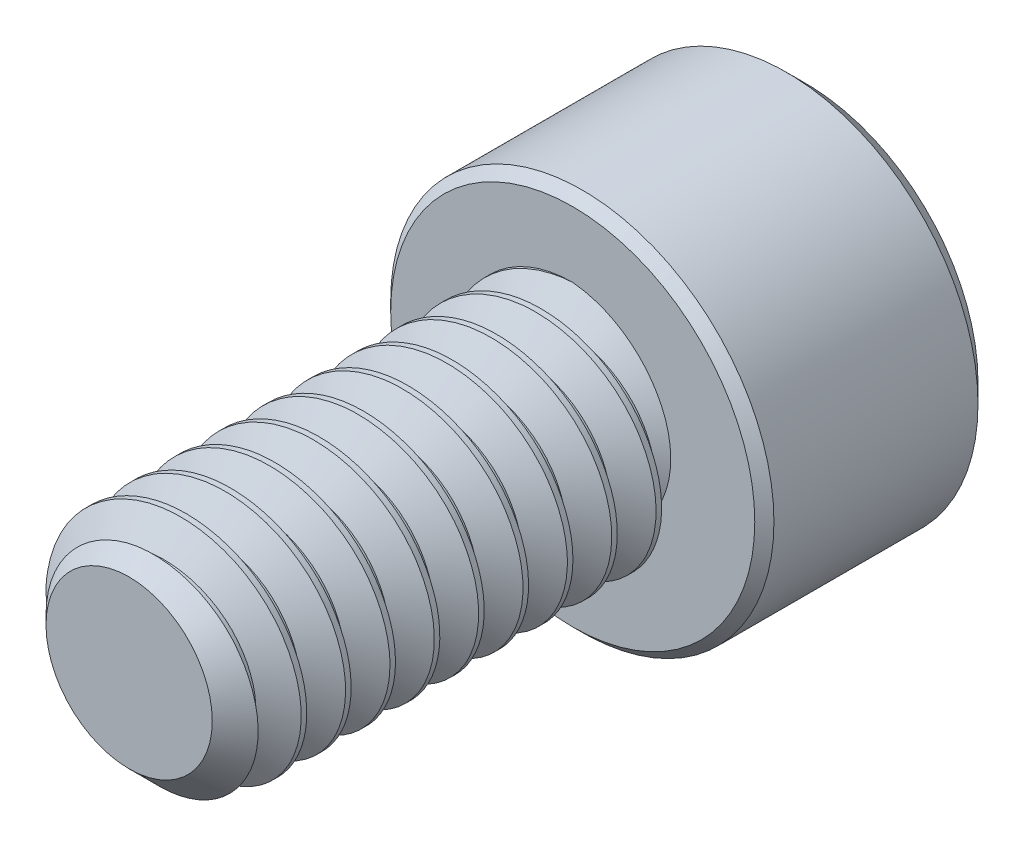
from build123d import *

# Parameters (mm, degrees)
SKETCH1_R          = 2.0828
EXTRUDE1_DEPTH     = 7.9375
CHAMFER3_SIZE      = 0.5953125
CUT_SWEEP1_PITCH   = 0.79375
SKETCH6_R          = 3.429
EXTRUDE2_DEPTH     = 4.1656
CUT_EXTRUDE1_DEPTH = 2.67890625
CHAMFER1_SIZE      = 0.3429
CHAMFER2_SIZE      = 0.17145


with BuildPart() as part:
    # Sketch1 → Extrude1 (new body)
    with BuildSketch(Plane.XY):
        Circle(SKETCH1_R)
    extrude(amount=-EXTRUDE1_DEPTH)

    # Chamfer3
    chamfer3_edges = [part.edges().sort_by_distance(p)[0] for p in [
        (-2.0828, 0, 0),
    ]]
    chamfer(chamfer3_edges, length=CHAMFER3_SIZE)

    # Cut-Sweep1: the profile of Sketch3 profile screwed along a right-hand helix of 11 turns, 6 arcs to a turn; built about Z, then put on its axis
    cut_sweep1_z = Axis((0, 0, 0), (0, 0, 1))
    cut_sweep1_corners = [(2.0831, 0, -0.694704455), (1.567244252, 0, -0.396875), (1.567244252, 0, -0.29765625), (2.0831, 0, 0.000173205)]
    with BuildLine(mode=Mode.PRIVATE) as cut_sweep1_profile:
        Line(cut_sweep1_corners[0], cut_sweep1_corners[1])
        Line(cut_sweep1_corners[1], cut_sweep1_corners[2])
        Line(cut_sweep1_corners[2], cut_sweep1_corners[3])
        Line(cut_sweep1_corners[3], cut_sweep1_corners[0])
    cut_sweep1_cap = Face(cut_sweep1_profile.wire())
    cut_sweep1_turn_angles = [0, 30, 60, 90, 120, 150, 180, 210, 240, 270, 300, 330, 360]
    cut_sweep1_turn_weights = [1, 0.8660254037844387, 1, 0.8660254037844387, 1, 0.8660254037844387, 1, 0.8660254037844387, 1, 0.8660254037844387, 1, 0.8660254037844387, 1]
    cut_sweep1_turn_rails = [Edge.make_bspline([Vector(p[0], p[1], 0).rotate(cut_sweep1_z, cut_sweep1_turn_angles[k]) / cut_sweep1_turn_weights[k] + Vector(0, 0, p[2] + CUT_SWEEP1_PITCH * cut_sweep1_turn_angles[k] / 360) for k in range(13)], [0, 0, 0, 1, 1, 2, 2, 3, 3, 4, 4, 5, 5, 6, 6, 6], 2, cut_sweep1_turn_weights) for p in cut_sweep1_corners]
    cut_sweep1_turn_sides = [Face.make_surface_from_curves(cut_sweep1_turn_rails[p[0]], cut_sweep1_turn_rails[p[1]]) for p in [(0, 1), (1, 2), (2, 3), (3, 0)]]
    cut_sweep1 = Plane(origin=(0, 0, 0), x_dir=(0, 1, 0), z_dir=(0, 0, -1)) * Solid(Shell([*[p.moved(Location((0, 0, CUT_SWEEP1_PITCH * i))) for i in range(11) for p in cut_sweep1_turn_sides], cut_sweep1_cap, cut_sweep1_cap.rotate(cut_sweep1_z, 3960).moved(Location((0, 0, CUT_SWEEP1_PITCH * 3960 / 360)))]))
    add(cut_sweep1, mode=Mode.SUBTRACT)

    # Sketch6 → Extrude2 (add)
    with BuildSketch(Plane(origin=(0, 0, -7.9375), x_dir=(-1, 0, 0), z_dir=(0, 0, -1))):
        Circle(SKETCH6_R)
    extrude(amount=EXTRUDE2_DEPTH)

    # Sketch7 → Cut-Extrude1 (cut)
    with BuildSketch(Plane(origin=(0, 0, -12.1031), x_dir=(-1, 0, 0), z_dir=(0, 0, -1))):
        Polygon((0, 2.062222993), (-1.7859375, 1.031111496), (-1.7859375, -1.031111496), (0, -2.062222993), (1.7859375, -1.031111496), (1.7859375, 1.031111496), align=None)
    extrude(amount=-CUT_EXTRUDE1_DEPTH, mode=Mode.SUBTRACT)

    # Cut-Extrude2 cone 1 section (through the dimple's axis) → Cut-Extrude2 (revolve, cut)
    with BuildSketch(Plane(origin=(0, 0, -12.1031), x_dir=(0, 1, 0), z_dir=(1, 0, 0))):
        Polygon((0, 0), (2.062222993, 0), (0, 2.062222993), align=None)
    revolve(axis=Axis((0, 0, -12.1031), (0, 0, 1)), mode=Mode.SUBTRACT)

    # Chamfer1
    chamfer1_edges = [part.edges().sort_by_distance(p)[0] for p in [
        (3.429, 0, -12.1031),
    ]]
    chamfer(chamfer1_edges, length=CHAMFER1_SIZE)

    # Chamfer2
    chamfer2_edges = [part.edges().sort_by_distance(p)[0] for p in [
        (3.429, 0, -7.9375),
    ]]
    chamfer(chamfer2_edges, length=CHAMFER2_SIZE)


solid = part.part
